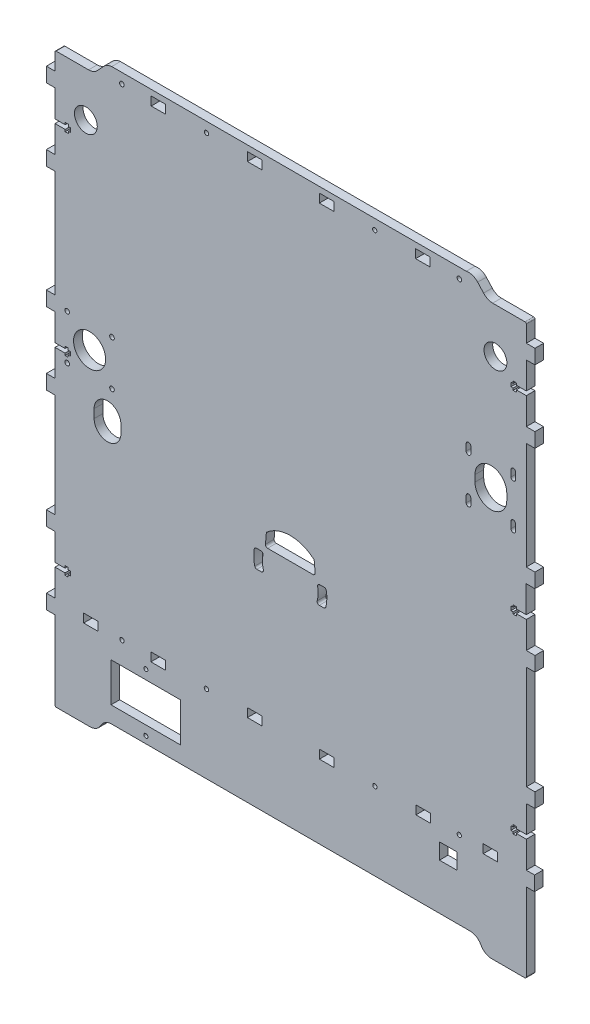
from build123d import *

# Parameters (mm, degrees)
SKETCH_1_R      = 7.9
SKETCH_1_R_2    = 1.6
SKETCH_1_R_3    = 1.5
SKETCH_1_R_4    = 11.1
SKETCH_1_R_5    = 1.4
SKETCH_1_W      = 10
SKETCH_1_H      = 6
SKETCH_1_W_2    = 12.1
SKETCH_1_H_2    = 11
SKETCH_1_W_3    = 48
SKETCH_1_H_3    = 27
EXTRUDE_1_DEPTH = 6


with BuildPart() as part:
    # Эскиз1 → Бобышка-Вытянуть1 (new body)
    with BuildSketch(Plane.XY):
        with BuildLine():
            Line((-197.487602206, 21.424334113), (-197.486561677, 20.054248176))
            Line((-197.486561677, 20.054248176), (-195.286801854, 20.054248176))
            Line((-195.286801854, 20.054248176), (-195.286817832, 21.426921304))
            Line((-195.286817832, 21.426921304), (-195.286801854, 21.454129382))
            Line((-195.286801854, 21.454129382), (-193.786801854, 21.454129382))
            Line((-193.786801854, 21.454129382), (-193.786801854, 24.24851002))
            Line((-193.786801854, 24.24851002), (-193.786785876, 24.275718097))
            Line((-193.786785876, 24.275718097), (-195.286785876, 24.275718097))
            Line((-195.286785876, 24.275718097), (-195.287641863, 25.64942725))
            Line((-195.287641863, 25.64942725), (-195.287642523, 25.676635332))
            Line((-195.287642523, 25.676635332), (-197.487642934, 25.676635332))
            Line((-197.487642934, 25.676635332), (-197.487638249, 25.64942725))
            Line((-197.487638249, 25.64942725), (-197.487435772, 24.276635347))
            Line((-197.487435772, 24.276635347), (-204.436337757, 24.276635347))
            Line((-204.436337757, 24.276635347), (-204.436337757, 42.876635347))
            Line((-204.436337757, 42.876635347), (-210.436337757, 42.876635347))
            Line((-210.436337757, 42.876635347), (-210.436337757, 52.876635347))
            Line((-210.436337757, 52.876635347), (-204.436337757, 52.876635347))
            Line((-204.436337757, 52.876635347), (-204.436337757, 127.036635347))
            Line((-204.436337757, 127.036635347), (-210.436337757, 127.036635347))
            Line((-210.436337757, 127.036635347), (-210.436337757, 137.036635347))
            Line((-210.436337757, 137.036635347), (-204.436337757, 137.036635347))
            Line((-204.436337757, 137.036635347), (-204.436337757, 155.636635347))
            Line((-204.436337757, 155.636635347), (-197.387139854, 155.636635347))
            Line((-197.387139854, 155.636635347), (-197.387139854, 154.236531323))
            Line((-197.387139854, 154.236531323), (-195.186317271, 154.236531323))
            Line((-195.186317271, 154.236531323), (-195.186317271, 155.618966061))
            Line((-195.186317271, 155.618966061), (-193.715479854, 155.618966061))
            Line((-193.715479854, 155.618966061), (-193.715479854, 158.418966061))
            Line((-193.715479854, 158.418966061), (-195.218141804, 158.418966061))
            Line((-195.218141804, 158.418966061), (-195.218141804, 159.836635347))
            Line((-195.218141804, 159.836635347), (-197.418142215, 159.836635347))
            Line((-197.418142215, 159.836635347), (-197.418142215, 158.436635347))
            Line((-197.418142215, 158.436635347), (-204.436337757, 158.436635347))
            Line((-204.436337757, 158.436635347), (-204.436337757, 177.036635347))
            Line((-204.436337757, 177.036635347), (-210.436337757, 177.036635347))
            Line((-210.436337757, 177.036635347), (-210.436337757, 187.036635347))
            Line((-210.436337757, 187.036635347), (-204.436337757, 187.036635347))
            Line((-204.436337757, 187.036635347), (-204.436337757, 198.258791497))
            ThreePointArc((-204.436337757, 198.258791497), (-204.328344016, 199.026576962), (-203.670309603, 199.436635347))
            Line((-203.670309603, 199.436635347), (-181.21366511, 199.436635347))
            ThreePointArc((-181.21366511, 199.436635347), (-177.786697283, 200.165852645), (-174.944614984, 202.214860835))
            Line((-174.944614984, 202.214860835), (-170.849061928, 206.694475052))
            ThreePointArc((-170.849061928, 206.694475052), (-168.285810468, 208.606816645), (-165.197330366, 209.436635347))
            Line((-165.197330366, 209.436635347), (80.233513167, 209.436635347))
            ThreePointArc((80.233513167, 209.436635347), (84.503563818, 209.155552648), (88.09552196, 206.829573983))
            Line((88.09552196, 206.829573983), (92.195746981, 202.354235654))
            ThreePointArc((92.195746981, 202.354235654), (95.023116575, 200.232431533), (98.467355239, 199.436635347))
            Line((98.467355239, 199.436635347), (120.843662243, 199.436635347))
            ThreePointArc((120.843662243, 199.436635347), (121.494200482, 199.167173586), (121.763662243, 198.516635347))
            Line((121.763662243, 198.516635347), (121.763662243, 187.036635347))
            Line((121.763662243, 187.036635347), (127.763662243, 187.036635347))
            Line((127.763662243, 187.036635347), (127.763662243, 177.036635347))
            Line((127.763662243, 177.036635347), (121.763662243, 177.036635347))
            Line((121.763662243, 177.036635347), (121.763662243, 158.436635347))
            Line((121.763662243, 158.436635347), (114.851661036, 158.436635347))
            Line((114.851661036, 158.436635347), (114.851661036, 159.836739372))
            Line((114.851661036, 159.836739372), (112.650838454, 159.836739372))
            Line((112.650838454, 159.836739372), (112.651660526, 158.436858407))
            Line((112.651660526, 158.436858407), (111.151660785, 158.435977541))
            Line((111.151660785, 158.435977541), (111.15330453, 155.636894735))
            Line((111.15330453, 155.636894735), (112.653304271, 155.637775601))
            Line((112.653304271, 155.637775601), (112.654126952, 154.236858346))
            Line((112.654126952, 154.236858346), (114.854127367, 154.236805006))
            Line((114.854127367, 154.236805006), (114.854161306, 155.636635347))
            Line((114.854161306, 155.636635347), (121.763662346, 155.636635347))
            Line((121.763662346, 155.636635347), (121.763662346, 137.036635347))
            Line((121.763662346, 137.036635347), (127.735522472, 137.036635347))
            Line((127.735522472, 137.036635347), (127.735522472, 127.036635347))
            Line((127.735522472, 127.036635347), (121.735522472, 127.036635347))
            Line((121.735522472, 127.036635347), (121.735522472, 52.876635347))
            Line((121.735522472, 52.876635347), (127.735522472, 52.876635347))
            Line((127.735522472, 52.876635347), (127.735522472, 42.876635347))
            Line((127.735522472, 42.876635347), (121.73141262, 42.876635347))
            Line((121.73141262, 42.876635347), (121.73141262, 24.276635347))
            Line((121.73141262, 24.276635347), (114.867621421, 24.276635347))
            Line((114.867621421, 24.276635347), (114.867616759, 24.303704553))
            Line((114.867616759, 24.303704553), (114.867380328, 25.676569221))
            Line((114.867380328, 25.676569221), (112.666557749, 25.676190201))
            Line((112.666557749, 25.676190201), (112.667616243, 24.303378605))
            Line((112.667616243, 24.303378605), (112.667620905, 24.276309399))
            Line((112.667620905, 24.276309399), (111.167621337, 24.275170207))
            Line((111.167621337, 24.275170207), (111.169742471, 21.503156931))
            Line((111.169742471, 21.503156931), (111.169747133, 21.476087726))
            Line((111.169747133, 21.476087726), (112.6697467, 21.477226918))
            Line((112.6697467, 21.477226918), (112.670805981, 20.103379031))
            Line((112.670805981, 20.103379031), (112.670810643, 20.076309825))
            Line((112.670810643, 20.076309825), (114.87081103, 20.076635363))
            Line((114.87081103, 20.076635363), (114.870806368, 20.103704568))
            Line((114.870806368, 20.103704568), (114.87060387, 21.476635347))
            Line((114.87060387, 21.476635347), (121.780104909, 21.476635347))
            Line((121.780104909, 21.476635347), (121.780104909, 2.876635347))
            Line((121.780104909, 2.876635347), (127.777161917, 2.876635347))
            Line((127.777161917, 2.876635347), (127.777161917, -7.123364653))
            Line((127.777161917, -7.123364653), (121.777161917, -7.123364653))
            Line((121.777161917, -7.123364653), (121.777161917, -78.853364653))
            Line((121.777161917, -78.853364653), (127.777161917, -78.853364653))
            Line((127.777161917, -78.853364653), (127.777161917, -88.853364653))
            Line((127.777161917, -88.853364653), (121.865168685, -88.853364653))
            Line((121.865168685, -88.853364653), (121.865168685, -107.433364653))
            Line((121.865168685, -107.433364653), (114.865167478, -107.433364653))
            Line((114.865167478, -107.433364653), (114.865167478, -106.033260628))
            Line((114.865167478, -106.033260628), (112.664344896, -106.033260628))
            Line((112.664344896, -106.033260628), (112.665166968, -107.433141593))
            Line((112.665166968, -107.433141593), (111.165167227, -107.434022459))
            Line((111.165167227, -107.434022459), (111.166810972, -110.233105265))
            Line((111.166810972, -110.233105265), (112.666810713, -110.232224399))
            Line((112.666810713, -110.232224399), (112.667633394, -111.633141654))
            Line((112.667633394, -111.633141654), (114.870838426, -111.633195072))
            Line((114.870838426, -111.633195072), (114.870872365, -110.233364653))
            Line((114.870872365, -110.233364653), (121.763662243, -110.233364653))
            Line((121.763662243, -110.233364653), (121.763662243, -128.843364653))
            Line((121.763662243, -128.843364653), (127.47801658, -128.843364653))
            Line((127.47801658, -128.843364653), (127.47801658, -138.843364653))
            Line((127.47801658, -138.843364653), (121.763662243, -138.843364653))
            Line((121.763662243, -138.843364653), (121.763662243, -192.691567269))
            ThreePointArc((121.763662243, -192.691567269), (121.517292149, -193.467005783), (120.806727052, -193.863364653))
            Line((120.806727052, -193.863364653), (97.806335191, -193.863364653))
            ThreePointArc((97.806335191, -193.863364653), (94.253903134, -193.044338241), (91.377078173, -190.805040153))
            Line((91.377078173, -190.805040153), (89.320374027, -187.785387058))
            ThreePointArc((89.320374027, -187.785387058), (86.401251485, -185.545465551), (82.80899626, -184.74908174))
            Line((82.80899626, -184.74908174), (-165.15931457, -184.74908174))
            ThreePointArc((-165.15931457, -184.74908174), (-168.751153818, -185.547339588), (-171.669107354, -187.788783751))
            Line((-171.669107354, -187.788783751), (-173.724235811, -190.809509456))
            ThreePointArc((-173.724235811, -190.809509456), (-176.639720291, -193.057976183), (-180.232351887, -193.863364653))
            Line((-180.232351887, -193.863364653), (-203.35849545, -193.863364653))
            ThreePointArc((-203.35849545, -193.863364653), (-204.158043867, -193.595905372), (-204.436337757, -192.800063271))
            Line((-204.436337757, -192.800063271), (-204.436337757, -138.843364653))
            Line((-204.436337757, -138.843364653), (-210.431075973, -138.843364653))
            Line((-210.431075973, -138.843364653), (-210.431075973, -128.843364653))
            Line((-210.431075973, -128.843364653), (-204.436337757, -128.843364653))
            Line((-204.436337757, -128.843364653), (-204.436337757, -110.233364653))
            Line((-204.436337757, -110.233364653), (-197.523921698, -110.233364653))
            Line((-197.523921698, -110.233364653), (-197.523672393, -111.68096837))
            Line((-197.523672393, -111.68096837), (-195.335013115, -111.679449577))
            Line((-195.335013115, -111.679449577), (-195.336806264, -110.279844178))
            Line((-195.336806264, -110.279844178), (-193.677914745, -110.277769726))
            Line((-193.677914745, -110.277769726), (-193.68325579, -107.284374899))
            Line((-193.68325579, -107.284374899), (-195.328101329, -107.286501137))
            Line((-195.328101329, -107.286501137), (-195.329942101, -105.895501094))
            Line((-195.329942101, -105.895501094), (-197.490847394, -105.897039343))
            Line((-197.490847394, -105.897039343), (-197.490620059, -107.433364653))
            Line((-197.490620059, -107.433364653), (-204.436337757, -107.433364653))
            Line((-204.436337757, -107.433364653), (-204.436337757, -88.853364653))
            Line((-204.436337757, -88.853364653), (-210.436337757, -88.853364653))
            Line((-210.436337757, -88.853364653), (-210.436337757, -78.853364653))
            Line((-210.436337757, -78.853364653), (-204.436337757, -78.853364653))
            Line((-204.436337757, -78.853364653), (-204.436337757, -7.123364653))
            Line((-204.436337757, -7.123364653), (-210.436337757, -7.123364653))
            Line((-210.436337757, -7.123364653), (-210.436337757, 2.876635347))
            Line((-210.436337757, 2.876635347), (-204.436337757, 2.876635347))
            Line((-204.436337757, 2.876635347), (-204.436337757, 21.456635347))
            Line((-204.436337757, 21.456635347), (-204.436337757, 21.476635347))
            Line((-204.436337757, 21.476635347), (-197.487641927, 21.476635347))
            Line((-197.487641927, 21.476635347), (-197.487602206, 21.424334113))
        make_face()
        with Locations((-183.086337757, 168.436635347)):
            Circle(SKETCH_1_R, mode=Mode.SUBTRACT)
        with Locations((100.408400459, 168.436635347)):
            Circle(SKETCH_1_R, mode=Mode.SUBTRACT)
        with Locations((-158.141599541, 202.436635347)):
            Circle(SKETCH_1_R_2, mode=Mode.SUBTRACT)
        with Locations((75.458400459, 202.436635347)):
            Circle(SKETCH_1_R_2, mode=Mode.SUBTRACT)
        with Locations((16.858400459, 202.436635347)):
            Circle(SKETCH_1_R_3, mode=Mode.SUBTRACT)
        with Locations((-99.541599541, 202.436635347)):
            Circle(SKETCH_1_R_3, mode=Mode.SUBTRACT)
        with Locations((-196.006387984, 47.305988871)):
            Circle(SKETCH_1_R_2, mode=Mode.SUBTRACT)
        with Locations((-165.006387984, 16.305988871)):
            Circle(SKETCH_1_R_2, mode=Mode.SUBTRACT)
        with Locations((-196.006387984, 16.305988871)):
            Circle(SKETCH_1_R_2, mode=Mode.SUBTRACT)
        with Locations((-180.506387984, 31.805988871)):
            Circle(SKETCH_1_R_4, mode=Mode.SUBTRACT)
        with Locations((-165.006387984, 47.305988871)):
            Circle(SKETCH_1_R_2, mode=Mode.SUBTRACT)
        with Locations((75.383662243, -130.863364653)):
            Circle(SKETCH_1_R_3, mode=Mode.SUBTRACT)
        with Locations((16.983662243, -130.863364653)):
            Circle(SKETCH_1_R_3, mode=Mode.SUBTRACT)
        with Locations((-99.656337757, -130.863364653)):
            Circle(SKETCH_1_R_3, mode=Mode.SUBTRACT)
        with Locations((-158.056337757, -130.863364653)):
            Circle(SKETCH_1_R_3, mode=Mode.SUBTRACT)
        with Locations((-141.555168688, -179.94908174)):
            Circle(SKETCH_1_R_5, mode=Mode.SUBTRACT)
        with Locations((-141.555168688, -139.94908174)):
            Circle(SKETCH_1_R_5, mode=Mode.SUBTRACT)
        with Locations((-16.416337757, -130.863364653)):
            Rectangle(SKETCH_1_W, SKETCH_1_H, mode=Mode.SUBTRACT)
        with Locations((-66.256337757, -130.863364653)):
            Rectangle(SKETCH_1_W, SKETCH_1_H, mode=Mode.SUBTRACT)
        with Locations((67.713662243, -147.363364653)):
            Rectangle(SKETCH_1_W_2, SKETCH_1_H_2, mode=Mode.SUBTRACT)
        with Locations((-133.056337757, -130.863364653)):
            Rectangle(SKETCH_1_W, SKETCH_1_H, mode=Mode.SUBTRACT)
        with Locations((-179.636337757, -130.863364653)):
            Rectangle(SKETCH_1_W, SKETCH_1_H, mode=Mode.SUBTRACT)
        with Locations((96.963662243, -130.863364653)):
            Rectangle(SKETCH_1_W, SKETCH_1_H, mode=Mode.SUBTRACT)
        with Locations((50.383662243, -130.863364653)):
            Rectangle(SKETCH_1_W, SKETCH_1_H, mode=Mode.SUBTRACT)
        with BuildLine():
            Line((-18.134599873, -29.194011129), (-21.184312759, -29.194011129))
            ThreePointArc((-21.184312759, -29.194011129), (-22.342493839, -29.740797309), (-22.65630504, -30.982522347))
            ThreePointArc((-22.65630504, -30.982522347), (-22.309250666, -35.408837109), (-22.983068573, -39.797308203))
            ThreePointArc((-22.983068573, -39.797308203), (-22.72917458, -41.103666451), (-21.536477135, -41.694011129))
            Line((-21.536477135, -41.694011129), (-18.440328783, -41.694011129))
            ThreePointArc((-18.440328783, -41.694011129), (-17.510284763, -41.370879057), (-16.980943477, -40.540701957))
            ThreePointArc((-16.980943477, -40.540701957), (-16.309095275, -35.507678983), (-16.655943039, -30.441872344))
            ThreePointArc((-16.655943039, -30.441872344), (-17.167182739, -29.547667337), (-18.134599873, -29.194011129))
        make_face(mode=Mode.SUBTRACT)
        with BuildLine():
            Line((-64.7445198, -41.694011128), (-61.648371447, -41.694011128))
            ThreePointArc((-61.648371447, -41.694011128), (-60.455674003, -41.103666451), (-60.201780009, -39.797308203))
            ThreePointArc((-60.201780009, -39.797308203), (-60.875597917, -35.408837109), (-60.528543542, -30.982522347))
            ThreePointArc((-60.528543542, -30.982522347), (-60.842354744, -29.740797309), (-62.000535824, -29.194011129))
            Line((-62.000535824, -29.194011129), (-65.05024871, -29.194011129))
            ThreePointArc((-65.05024871, -29.194011129), (-66.017665844, -29.547667337), (-66.528905544, -30.441872344))
            ThreePointArc((-66.528905544, -30.441872344), (-66.875753307, -35.507678983), (-66.203905105, -40.540701957))
            ThreePointArc((-66.203905105, -40.540701957), (-65.67456382, -41.370879057), (-64.7445198, -41.694011128))
        make_face(mode=Mode.SUBTRACT)
        with BuildLine():
            Line((-58.18830834, -16.824477467), (-58.795688036, -23.766859164))
            ThreePointArc((-58.795688036, -23.766859164), (-58.407311994, -24.91097809), (-57.301395989, -25.397592779))
            Line((-57.301395989, -25.397592779), (-25.883452594, -25.397592779))
            ThreePointArc((-25.883452594, -25.397592779), (-24.777536589, -24.91097809), (-24.389160547, -23.766859164))
            Line((-24.389160547, -23.766859164), (-24.996540243, -16.824477467))
            ThreePointArc((-24.996540243, -16.824477467), (-25.15785371, -16.267338924), (-25.518477328, -15.813052674))
            ThreePointArc((-25.518477328, -15.813052674), (-41.592424291, -9.897592775), (-57.666371255, -15.813052674))
            ThreePointArc((-57.666371255, -15.813052674), (-58.026994873, -16.267338924), (-58.18830834, -16.824477467))
        make_face(mode=Mode.SUBTRACT)
        with Locations((-141.692424291, -159.912798349)):
            Rectangle(SKETCH_1_W_3, SKETCH_1_H_3, mode=Mode.SUBTRACT)
        with Locations((-132.841599541, 202.436635347)):
            Rectangle(SKETCH_1_W, SKETCH_1_H, mode=Mode.SUBTRACT)
        with Locations((50.158400459, 202.436635347)):
            Rectangle(SKETCH_1_W, SKETCH_1_H, mode=Mode.SUBTRACT)
        with Locations((-66.241599541, 202.436635347)):
            Rectangle(SKETCH_1_W, SKETCH_1_H, mode=Mode.SUBTRACT)
        with Locations((-16.441599541, 202.436635347)):
            Rectangle(SKETCH_1_W, SKETCH_1_H, mode=Mode.SUBTRACT)
        with BuildLine():
            Line((-158.856387984, -7.694011129), (-158.856387984, -1.694011129))
            ThreePointArc((-158.856387984, -1.694011129), (-168.106387984, 7.555988871), (-177.356387984, -1.694011129))
            Line((-177.356387984, -1.694011129), (-177.356387984, -7.694011129))
            ThreePointArc((-177.356387984, -7.694011129), (-168.106387984, -16.944011129), (-158.856387984, -7.694011129))
        make_face(mode=Mode.SUBTRACT)
        with BuildLine():
            Line((86.257214298, 90.555988871), (86.257214298, 86.055988871))
            ThreePointArc((86.257214298, 86.055988871), (97.257214298, 75.055988871), (108.257214298, 86.055988871))
            Line((108.257214298, 86.055988871), (108.257214298, 90.555988871))
            ThreePointArc((108.257214298, 90.555988871), (97.257214298, 101.555988871), (86.257214298, 90.555988871))
        make_face(mode=Mode.SUBTRACT)
        with BuildLine():
            Line((111.157214298, 75.055988871), (111.157214298, 70.555988871))
            ThreePointArc((111.157214298, 70.555988871), (112.757214298, 68.955988871), (114.357214298, 70.555988871))
            Line((114.357214298, 70.555988871), (114.357214298, 75.055988871))
            ThreePointArc((114.357214298, 75.055988871), (112.757214298, 76.655988871), (111.157214298, 75.055988871))
        make_face(mode=Mode.SUBTRACT)
        with BuildLine():
            Line((114.357214298, 101.555988871), (114.357214298, 106.055988871))
            ThreePointArc((114.357214298, 106.055988871), (112.757214298, 107.655988871), (111.157214298, 106.055988871))
            Line((111.157214298, 106.055988871), (111.157214298, 101.555988871))
            ThreePointArc((111.157214298, 101.555988871), (112.757214298, 99.955988871), (114.357214298, 101.555988871))
        make_face(mode=Mode.SUBTRACT)
        with BuildLine():
            Line((80.157214298, 75.055988871), (80.157214298, 70.555988871))
            ThreePointArc((80.157214298, 70.555988871), (81.757214298, 68.955988871), (83.357214298, 70.555988871))
            Line((83.357214298, 70.555988871), (83.357214298, 75.055988871))
            ThreePointArc((83.357214298, 75.055988871), (81.757214298, 76.655988871), (80.157214298, 75.055988871))
        make_face(mode=Mode.SUBTRACT)
        with BuildLine():
            Line((83.357214298, 101.555988871), (83.357214298, 106.055988871))
            ThreePointArc((83.357214298, 106.055988871), (81.757214298, 107.655988871), (80.157214298, 106.055988871))
            Line((80.157214298, 106.055988871), (80.157214298, 101.555988871))
            ThreePointArc((80.157214298, 101.555988871), (81.757214298, 99.955988871), (83.357214298, 101.555988871))
        make_face(mode=Mode.SUBTRACT)
    extrude(amount=EXTRUDE_1_DEPTH)


solid = part.part
